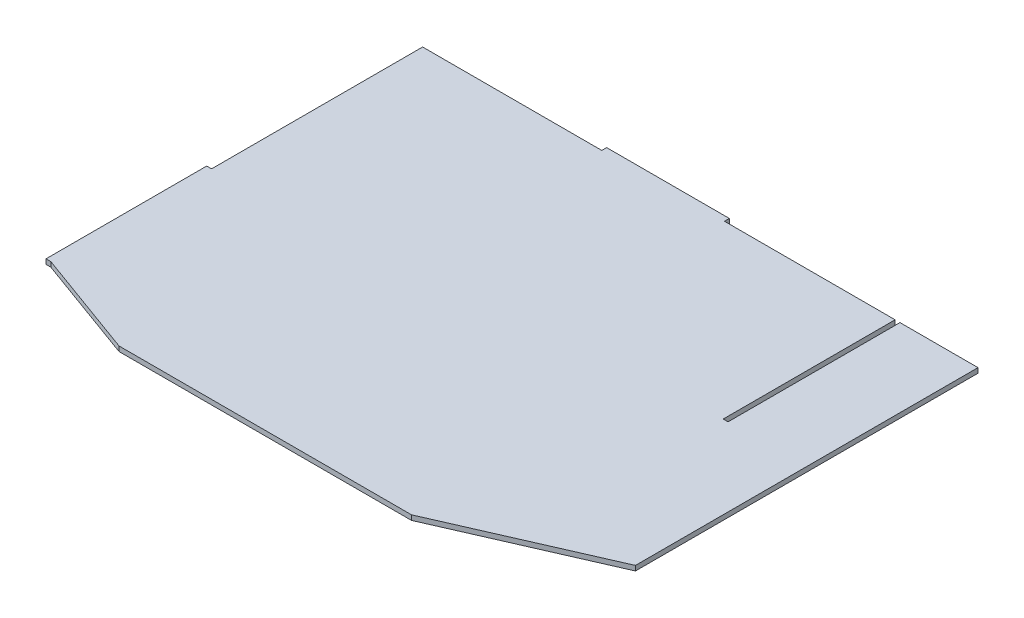
from build123d import *

# Parameters (mm, degrees)
SKETCH1_W           = 308.1112
SKETCH1_H           = 3.175
BOSS_EXTRUDE1_DEPTH = 267.83
SKETCH3_W           = 155.702
SKETCH3_H           = 3.175
BOSS_EXTRUDE3_DEPTH = 3.175
SKETCH4_W           = 50.87366
SKETCH4_H           = 3.175
BOSS_EXTRUDE4_DEPTH = 267.83
CUT_EXTRUDE1_DEPTH  = 340.190761306
SKETCH8_W           = 80
SKETCH8_H           = 3.175
BOSS_EXTRUDE6_DEPTH = 3.175
CUT_EXTRUDE3_DEPTH  = 340.190761306
SKETCH13_W          = 104.779999964
SKETCH13_H          = 3.1854967
BOSS_EXTRUDE7_DEPTH = 3.175


with BuildPart() as part:
    # Sketch1 → Boss-Extrude1 (new body)
    with BuildSketch(Plane.XY):
        Rectangle(SKETCH1_W, SKETCH1_H)
    extrude(amount=BOSS_EXTRUDE1_DEPTH)

    # Sketch3 → Boss-Extrude3 (add)
    with BuildSketch(Plane(origin=(154.0556, 0, 0), x_dir=(0, 0, -1), z_dir=(1, 0, 0))):
        with Locations((-189.979, 0)):
            Rectangle(SKETCH3_W, SKETCH3_H)
    extrude(amount=BOSS_EXTRUDE3_DEPTH)

    # Sketch4 → Boss-Extrude4 (add)
    with BuildSketch(Plane.XY.offset(267.83)):
        with Locations((182.66743, 0)):
            Rectangle(SKETCH4_W, SKETCH4_H)
    extrude(amount=-BOSS_EXTRUDE4_DEPTH)

    # Sketch6 → Cut-Extrude1 (cut, through all)
    with BuildSketch(Plane(origin=(0, 1.5875, 0), x_dir=(1, 0, 0), z_dir=(0, 1, 0))):
        Polygon((208.10426, -223.38), (106.50426, -267.83), (208.10426, -267.83), align=None)
    extrude(amount=-CUT_EXTRUDE1_DEPTH, mode=Mode.SUBTRACT)

    # Sketch8 → Boss-Extrude6 (add)
    with BuildSketch(Plane(origin=(0, 0, 0), x_dir=(-1, 0, 0), z_dir=(0, 0, -1))):
        with Locations((-2.78399998, 0)):
            Rectangle(SKETCH8_W, SKETCH8_H)
    extrude(amount=BOSS_EXTRUDE6_DEPTH)

    # Sketch11 → Cut-Extrude3 (cut, through all)
    with BuildSketch(Plane.XZ.offset(1.5875)):
        Polygon((-154.0556, 242.43), (-84.2056, 267.83), (-154.0556, 267.83), align=None)
    extrude(amount=-CUT_EXTRUDE3_DEPTH, mode=Mode.SUBTRACT)

    # Sketch13 → Boss-Extrude7 (add)
    with BuildSketch(Plane.ZY.offset(154.0556)):
        with Locations((190.040000018, -0.00524835)):
            Rectangle(SKETCH13_W, SKETCH13_H)
    extrude(amount=BOSS_EXTRUDE7_DEPTH)


solid = part.part
